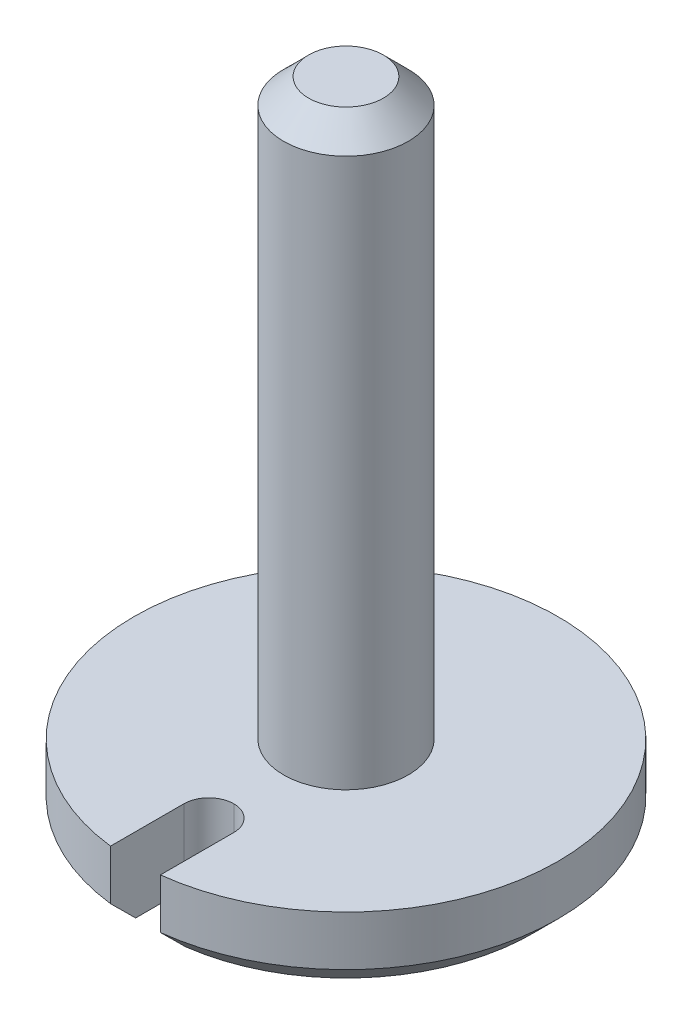
from build123d import *

# Parameters (mm, degrees)
SKETCH1_R           = 2.5
BOSS_EXTRUDE1_DEPTH = 23
CHAMFER1_SIZE       = 1
SKETCH2_R           = 8.5
BOSS_EXTRUDE2_DEPTH = 3
SKETCH3_W           = 2
SKETCH3_H           = 8
CUT_EXTRUDE1_DEPTH  = 3
FILLET1_R           = 1
CHAMFER2_SIZE       = 1


with BuildPart() as part:
    # Sketch1 → Boss-Extrude1 (new body)
    with BuildSketch(Plane(origin=(0, 0, 0), x_dir=(1, 0, 0), z_dir=(0, 1, 0))):
        with Locations(Location((0, 0, 0), (0, 0, 270))):
            Circle(SKETCH1_R)
    extrude(amount=BOSS_EXTRUDE1_DEPTH)

    # Chamfer1
    chamfer1_edges = [part.edges().sort_by_distance(p)[0] for p in [
        (0, 23, -2.5),
    ]]
    chamfer(chamfer1_edges, length=CHAMFER1_SIZE)

    # Sketch2 → Boss-Extrude2 (add)
    with BuildSketch(Plane.XZ):
        with Locations(Location((0, 0, 0), (0, 0, 270))):
            Circle(SKETCH2_R)
    extrude(amount=BOSS_EXTRUDE2_DEPTH)

    # Sketch3 → Cut-Extrude1 (cut)
    with BuildSketch(Plane.XZ.offset(3)):
        with Locations((0, 8.5)):
            Rectangle(SKETCH3_W, SKETCH3_H)
    extrude(amount=-CUT_EXTRUDE1_DEPTH, mode=Mode.SUBTRACT)

    # Fillet1
    fillet1_edges = [part.edges().sort_by_distance(p)[0] for p in [
        (-1, -1.5, 4.5),
        (1, -1.5, 4.5),
    ]]
    fillet(fillet1_edges, radius=FILLET1_R - 0.0001)  # a hair under: the kernel refuses the full size

    # Chamfer2
    chamfer2_edges = [part.edges().sort_by_distance(p)[0] for p in [
        (-8.485230045, -3, -0.500870333),
    ]]
    chamfer(chamfer2_edges, length=CHAMFER2_SIZE)


solid = part.part
